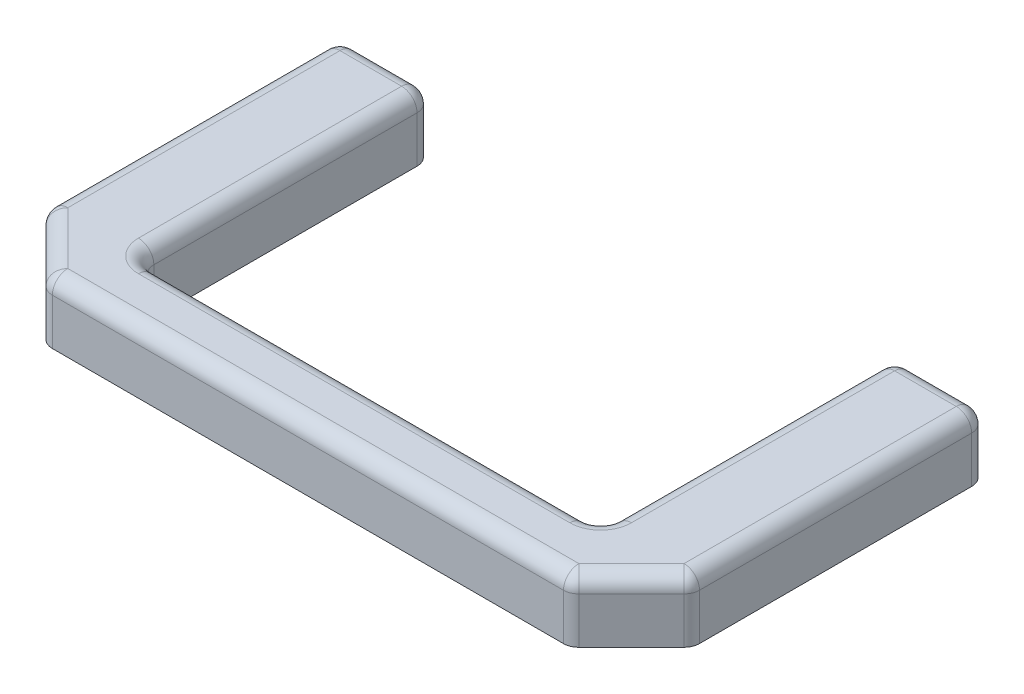
from build123d import *

# Parameters (mm, degrees)
BOSS_EXTRUDE1_DEPTH = 6.35
SKETCH2_R           = 1.905
CUT_EXTRUDE1_DEPTH  = 6.35
CHAMFER1_SIZE       = 6.35
FILLET2_R           = 1.5875


with BuildPart() as part:
    # Sketch1 → Boss-Extrude1 (new body)
    with BuildSketch(Plane(origin=(0, 0, 0), x_dir=(1, 0, 0), z_dir=(0, 1, 0))):
        Polygon((-33.3375, 0), (33.3375, 0), (33.3375, 36.6395), (23.8125, 36.6395), (23.8125, 6.35), (-23.8125, 6.35), (-23.8125, 36.6395), (-33.3375, 36.6395), align=None)
    extrude(amount=BOSS_EXTRUDE1_DEPTH)

    # Sketch2 → Cut-Extrude1 (cut)
    with BuildSketch(Plane(origin=(0, 0, -36.6395), x_dir=(-1, 0, 0), z_dir=(0, 0, -1))):
        with Locations((-28.575, 3.175)):
            Circle(SKETCH2_R)
    cut_extrude1 = extrude(amount=-CUT_EXTRUDE1_DEPTH, mode=Mode.SUBTRACT)

    # Mirror1: Cut-Extrude1 across plane
    add(cut_extrude1.mirror(Plane(origin=(0, 0, 0), x_dir=(0, 0, 1), z_dir=(1, 0, 0))), mode=Mode.SUBTRACT)

    # Chamfer1
    chamfer1_edges = [part.edges().sort_by_distance(p)[0] for p in [
        (33.3375, 3.175, 0),
        (-33.3375, 3.175, 0),
    ]]
    chamfer(chamfer1_edges, length=CHAMFER1_SIZE)

    # Fillet2
    # the kernel refuses this fillet: 1.5875 mm, written as the material it adds along each edge
    with BuildSketch(Plane(origin=(-23.8125, 0, -6.35), x_dir=(0, 0, -1), z_dir=(0, 1, 0))) as fillet2_piece_1:
        with BuildLine():
            CenterArc((FILLET2_R, -FILLET2_R), FILLET2_R, 90, 90)
            Line((0, -FILLET2_R), (0, 0))
            Line((0, 0), (FILLET2_R, 0))
        make_face()
    extrude(amount=6.35)
    with BuildSketch(Plane(origin=(23.8125, 0, -6.35), x_dir=(0, 0, -1), z_dir=(0, 1, 0))) as fillet2_piece_2:
        with BuildLine():
            CenterArc((FILLET2_R, FILLET2_R), FILLET2_R, 180, 90)
            Line((0, FILLET2_R), (0, 0))
            Line((0, 0), (FILLET2_R, 0))
        make_face()
    extrude(amount=6.35)
    # the kernel refuses this fillet: 1.5875 mm, written as the material it takes off along each edge
    with BuildSketch(Plane(origin=(-31.75, 4.7625, -35.052), x_dir=(-1, 0, 0), z_dir=(0, 1, 0))) as fillet2_2_piece_1_section:
        Polygon((0, 0), (FILLET2_R, 0), (FILLET2_R, -FILLET2_R), (0, -FILLET2_R), align=None)
    fillet2_2_piece_1 = extrude(amount=FILLET2_R, mode=Mode.PRIVATE)
    fillet2_2_piece_1 = fillet2_2_piece_1 - Plane(origin=(-31.75, 4.7625, -35.052), x_dir=(0.7071067811865475, 0, 0.7071067811865475), z_dir=(0, 1, 0)) * Sphere(FILLET2_R, mode=Mode.PRIVATE)
    add(fillet2_2_piece_1, mode=Mode.SUBTRACT)
    with BuildSketch(Plane(origin=(31.75, 4.7625, -35.052), x_dir=(0, 1, 0), z_dir=(0, 0, -1))) as fillet2_2_piece_2_section:
        Polygon((0, 0), (FILLET2_R, 0), (FILLET2_R, FILLET2_R), (0, FILLET2_R), align=None)
    fillet2_2_piece_2 = extrude(amount=FILLET2_R, mode=Mode.PRIVATE)
    fillet2_2_piece_2 = fillet2_2_piece_2 - Plane(origin=(31.75, 4.7625, -35.052), x_dir=(-0.7071067811865475, -0.7071067811865475, 0), z_dir=(0, 0, -1)) * Sphere(FILLET2_R, mode=Mode.PRIVATE)
    add(fillet2_2_piece_2, mode=Mode.SUBTRACT)
    with BuildSketch(Plane(origin=(-26.32993597, 4.7625, -1.5875), x_dir=(0, 0, 1), z_dir=(0, 1, 0))) as fillet2_2_piece_3_section:
        Polygon((0, 0), (FILLET2_R, 0), (FILLET2_R, -FILLET2_R * 0.414213562373), (FILLET2_R * 0.707106781187, -FILLET2_R * 0.707106781187), align=None)
    fillet2_2_piece_3 = extrude(amount=FILLET2_R, mode=Mode.PRIVATE)
    fillet2_2_piece_3 = fillet2_2_piece_3 - Plane(origin=(-26.32993597, 4.7625, -1.5875), x_dir=(0.38268343236508956, 0, -0.9238795325112867), z_dir=(0, 1, 0)) * Sphere(FILLET2_R, mode=Mode.PRIVATE)
    add(fillet2_2_piece_3, mode=Mode.SUBTRACT)
    with BuildSketch(Plane(origin=(26.32993597, 4.7625, -1.5875), x_dir=(0, 0, 1), z_dir=(0, 1, 0))) as fillet2_2_piece_4_section:
        Polygon((0, 0), (FILLET2_R, 0), (FILLET2_R, FILLET2_R * 0.414213562373), (FILLET2_R * 0.707106781187, FILLET2_R * 0.707106781187), align=None)
    fillet2_2_piece_4 = extrude(amount=FILLET2_R, mode=Mode.PRIVATE)
    fillet2_2_piece_4 = fillet2_2_piece_4 - Plane(origin=(26.32993597, 4.7625, -1.5875), x_dir=(-0.3826834323650899, 0, -0.9238795325112866), z_dir=(0, 1, 0)) * Sphere(FILLET2_R, mode=Mode.PRIVATE)
    add(fillet2_2_piece_4, mode=Mode.SUBTRACT)
    with BuildSketch(Plane(origin=(-31.75, 4.7625, -7.00756403), x_dir=(-1, 0, 0), z_dir=(0, 1, 0))) as fillet2_2_piece_5_section:
        Polygon((0, 0), (FILLET2_R, 0), (FILLET2_R, FILLET2_R * 0.414213562373), (FILLET2_R * 0.707106781187, FILLET2_R * 0.707106781187), align=None)
    fillet2_2_piece_5 = extrude(amount=FILLET2_R, mode=Mode.PRIVATE)
    fillet2_2_piece_5 = fillet2_2_piece_5 - Plane(origin=(-31.75, 4.7625, -7.00756403), x_dir=(0.9238795325112866, 0, -0.38268343236508984), z_dir=(0, 1, 0)) * Sphere(FILLET2_R, mode=Mode.PRIVATE)
    add(fillet2_2_piece_5, mode=Mode.SUBTRACT)
    with BuildSketch(Plane(origin=(31.75, 4.7625, -7.00756403), x_dir=(1, 0, 0), z_dir=(0, 1, 0))) as fillet2_2_piece_6_section:
        Polygon((0, 0), (FILLET2_R, 0), (FILLET2_R, -FILLET2_R * 0.414213562373), (FILLET2_R * 0.707106781187, -FILLET2_R * 0.707106781187), align=None)
    fillet2_2_piece_6 = extrude(amount=FILLET2_R, mode=Mode.PRIVATE)
    fillet2_2_piece_6 = fillet2_2_piece_6 - Plane(origin=(31.75, 4.7625, -7.00756403), x_dir=(-0.9238795325112868, 0, -0.38268343236508967), z_dir=(0, 1, 0)) * Sphere(FILLET2_R, mode=Mode.PRIVATE)
    add(fillet2_2_piece_6, mode=Mode.SUBTRACT)
    with BuildSketch(Plane(origin=(-33.3375, -3.96875, -36.6395), x_dir=(0, 0, 1), z_dir=(0, 1, 0))) as fillet2_2_piece_7:
        with BuildLine():
            CenterArc((FILLET2_R, FILLET2_R), FILLET2_R, 180, 90)
            Line((0, FILLET2_R), (0, 0))
            Line((0, 0), (FILLET2_R, 0))
        make_face()
    extrude(amount=8.73125, mode=Mode.SUBTRACT)
    with BuildSketch(Plane(origin=(-23.8125, -3.96875, -36.6395), x_dir=(-1, 0, 0), z_dir=(0, 1, 0))) as fillet2_2_piece_8:
        with BuildLine():
            CenterArc((FILLET2_R, FILLET2_R), FILLET2_R, 180, 90)
            Line((0, FILLET2_R), (0, 0))
            Line((0, 0), (FILLET2_R, 0))
        make_face()
    extrude(amount=14.2875, mode=Mode.SUBTRACT)
    with BuildSketch(Plane(origin=(23.8125, -3.96875, -36.6395), x_dir=(1, 0, 0), z_dir=(0, 1, 0))) as fillet2_2_piece_9:
        with BuildLine():
            CenterArc((FILLET2_R, -FILLET2_R), FILLET2_R, 90, 90)
            Line((0, -FILLET2_R), (0, 0))
            Line((0, 0), (FILLET2_R, 0))
        make_face()
    extrude(amount=14.2875, mode=Mode.SUBTRACT)
    with BuildSketch(Plane(origin=(33.3375, -3.96875, -36.6395), x_dir=(0, 0, 1), z_dir=(0, 1, 0))) as fillet2_2_piece_10:
        with BuildLine():
            CenterArc((FILLET2_R, -FILLET2_R), FILLET2_R, 90, 90)
            Line((0, -FILLET2_R), (0, 0))
            Line((0, 0), (FILLET2_R, 0))
        make_face()
    extrude(amount=8.73125, mode=Mode.SUBTRACT)
    with BuildSketch(Plane(origin=(31.75, 6.35, -36.6395), x_dir=(0, 0, 1), z_dir=(-1, 0, 0)), Plane(origin=(-19.84375, 6.35, -36.6395), x_dir=(0, 0, 1), z_dir=(-1, 0, 0))) as fillet2_2_piece_11:
        with BuildLine():
            CenterArc((FILLET2_R, -FILLET2_R), FILLET2_R, 90, 90)
            Line((0, -FILLET2_R), (0, 0))
            Line((0, 0), (FILLET2_R, 0))
        make_face()
    extrude(amount=11.90625, mode=Mode.SUBTRACT)
    with BuildSketch(Plane(origin=(-26.32993597, 6.35, 0), x_dir=(0, -1, 0), z_dir=(1, 0, 0))) as fillet2_2_piece_12:
        with BuildLine():
            CenterArc((FILLET2_R, FILLET2_R), FILLET2_R, 180, 90)
            Line((0, FILLET2_R), (0, 0))
            Line((0, 0), (FILLET2_R, 0))
        make_face()
    extrude(amount=52.659871939, mode=Mode.SUBTRACT)
    with BuildSketch(Plane(origin=(26.9875, -1.643910076, 0), x_dir=(-1, 0, 0), z_dir=(0, 1, 0)), Plane(origin=(33.3375, -1.643910076, -6.35), x_dir=(-0.7071067811865448, 0, 0.7071067811865502), z_dir=(0, 1, 0))) as fillet2_2_piece_13:
        with BuildLine():
            CenterArc((FILLET2_R * 0.414213562373, -FILLET2_R), FILLET2_R, 90, 45)
            Line((-FILLET2_R * 0.292893218813, -FILLET2_R * 0.292893218813), (0, 0))
            Line((0, 0), (FILLET2_R * 0.414213562373, 0))
        make_face()
    extrude(amount=6.406410076, mode=Mode.SUBTRACT)
    with BuildSketch(Plane(origin=(-26.9875, -1.643910076, 0), x_dir=(1, 0, 0), z_dir=(0, 1, 0)), Plane(origin=(-33.3375, -1.643910076, -6.35), x_dir=(0.7071067811865468, 0, 0.7071067811865482), z_dir=(0, 1, 0))) as fillet2_2_piece_14:
        with BuildLine():
            CenterArc((FILLET2_R * 0.414213562373, FILLET2_R), FILLET2_R, 225, 45)
            Line((-FILLET2_R * 0.292893218813, FILLET2_R * 0.292893218813), (0, 0))
            Line((0, 0), (FILLET2_R * 0.414213562373, 0))
        make_face()
    extrude(amount=6.406410076, mode=Mode.SUBTRACT)
    with BuildSketch(Plane(origin=(33.3375, 6.35, -7.00756403), x_dir=(-1, 0, 0), z_dir=(0, 0, -1)), Plane(origin=(-33.3375, 6.35, -35.052), x_dir=(1, 0, 0), z_dir=(0, 0, 1))) as fillet2_2_piece_15:
        with BuildLine():
            CenterArc((FILLET2_R, -FILLET2_R), FILLET2_R, 90, 90)
            Line((0, -FILLET2_R), (0, 0))
            Line((0, 0), (FILLET2_R, 0))
        make_face()
    extrude(amount=28.04443597, mode=Mode.SUBTRACT)
    with BuildSketch(Plane(origin=(27.452467985, 6.35, -0.464967985), x_dir=(0, -1, 0), z_dir=(0.7071067811865476, 0, -0.7071067811865476))) as fillet2_2_piece_16:
        with BuildLine():
            CenterArc((FILLET2_R, FILLET2_R), FILLET2_R, 180, 90)
            Line((0, FILLET2_R), (0, 0))
            Line((0, 0), (FILLET2_R, 0))
        make_face()
    extrude(amount=7.665128061, mode=Mode.SUBTRACT)
    with BuildSketch(Plane(origin=(-27.452467985, 6.35, -0.464967985), x_dir=(0, -1, 0), z_dir=(-0.7071067811865477, 0, -0.7071067811865475))) as fillet2_2_piece_17:
        with BuildLine():
            CenterArc((FILLET2_R, -FILLET2_R), FILLET2_R, 90, 90)
            Line((0, -FILLET2_R), (0, 0))
            Line((0, 0), (FILLET2_R, 0))
        make_face()
    extrude(amount=7.665128061, mode=Mode.SUBTRACT)
    # the kernel refuses this fillet: 1.5875 mm, written as the material it takes off along each edge
    with BuildSketch(Plane(origin=(-25.4, 4.7625, -35.052), x_dir=(0, 1, 0), z_dir=(1, 0, 0))) as fillet2_3_piece_1_section:
        Polygon((0, 0), (FILLET2_R, 0), (FILLET2_R, -FILLET2_R), (0, -FILLET2_R), align=None)
    fillet2_3_piece_1 = extrude(amount=FILLET2_R, mode=Mode.PRIVATE)
    fillet2_3_piece_1 = fillet2_3_piece_1 - Plane(origin=(-25.4, 4.7625, -35.052), x_dir=(0, -0.7071067811865475, 0.7071067811865475), z_dir=(1, 0, 0)) * Sphere(FILLET2_R, mode=Mode.PRIVATE)
    add(fillet2_3_piece_1, mode=Mode.SUBTRACT)
    with BuildSketch(Plane(origin=(25.4, 4.7625, -35.052), x_dir=(0, 1, 0), z_dir=(-1, 0, 0))) as fillet2_3_piece_2_section:
        Polygon((0, 0), (FILLET2_R, 0), (FILLET2_R, FILLET2_R), (0, FILLET2_R), align=None)
    fillet2_3_piece_2 = extrude(amount=FILLET2_R, mode=Mode.PRIVATE)
    fillet2_3_piece_2 = fillet2_3_piece_2 - Plane(origin=(25.4, 4.7625, -35.052), x_dir=(0, -0.7071067811865475, 0.7071067811865475), z_dir=(-1, 0, 0)) * Sphere(FILLET2_R, mode=Mode.PRIVATE)
    add(fillet2_3_piece_2, mode=Mode.SUBTRACT)
    with BuildSketch(Plane(origin=(23.8125, 6.35, -35.052), x_dir=(0, -1, 0), z_dir=(0, 0, 1)), Plane(origin=(-23.8125, 6.35, -7.9375), x_dir=(0, -1, 0), z_dir=(0, 0, -1))) as fillet2_3_piece_3:
        with BuildLine():
            CenterArc((FILLET2_R, FILLET2_R), FILLET2_R, 180, 90)
            Line((0, FILLET2_R), (0, 0))
            Line((0, 0), (FILLET2_R, 0))
        make_face()
    extrude(amount=27.1145, mode=Mode.SUBTRACT)
    with BuildSketch(Plane(origin=(22.225, 6.35, -6.35), x_dir=(0, -1, 0), z_dir=(-1, 0, 0))) as fillet2_3_piece_4:
        with BuildLine():
            CenterArc((FILLET2_R, FILLET2_R), FILLET2_R, 180, 90)
            Line((0, FILLET2_R), (0, 0))
            Line((0, 0), (FILLET2_R, 0))
        make_face()
    extrude(amount=44.45, mode=Mode.SUBTRACT)
    with BuildSketch(Plane(origin=(-22.225, 6.35, -7.9375), x_dir=(-1, 0, 0), z_dir=(0, 0, -1))) as fillet2_3_piece_5:
        with BuildLine():
            CenterArc((1.5875 + FILLET2_R, -FILLET2_R), FILLET2_R, 90, 90)
            Line((1.5875 + FILLET2_R, 0), (1.5875, 0))
            Line((1.5875, 0), (1.5875, -FILLET2_R))
        make_face()
    revolve(axis=Axis((-22.225, 6.35, -7.9375), (0, 1, 0)), revolution_arc=90, mode=Mode.SUBTRACT)
    with BuildSketch(Plane(origin=(22.225, 6.35, -7.9375), x_dir=(1, 0, 0), z_dir=(0, 0, -1))) as fillet2_3_piece_6:
        with BuildLine():
            CenterArc((1.5875 + FILLET2_R, FILLET2_R), FILLET2_R, 180, 90)
            Line((1.5875 + FILLET2_R, 0), (1.5875, 0))
            Line((1.5875, 0), (1.5875, FILLET2_R))
        make_face()
    revolve(axis=Axis((22.225, 6.35, -7.9375), (0, -1, 0)), revolution_arc=90, mode=Mode.SUBTRACT)


solid = part.part
